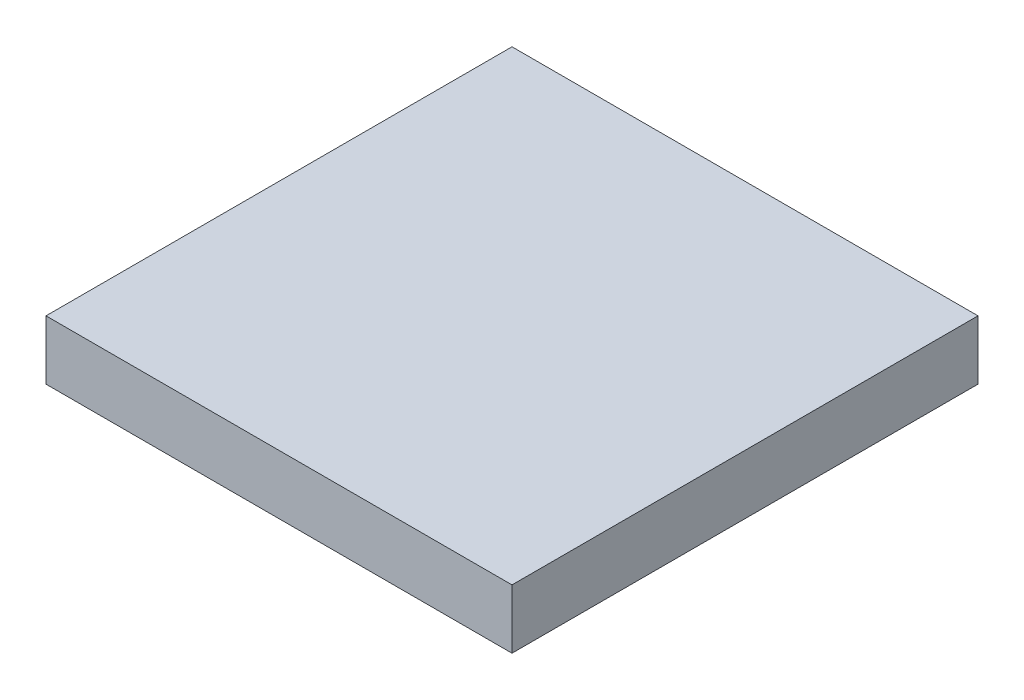
from build123d import *

# Parameters (mm, degrees)
SKETCH1_W           = 100
SKETCH1_H           = 100
BOSS_EXTRUDE1_DEPTH = 12.7


with BuildPart() as part:
    # Sketch1 → Boss-Extrude1 (new body)
    with BuildSketch(Plane(origin=(0, 0, 0), x_dir=(1, 0, 0), z_dir=(0, 1, 0))):
        with Locations((50, 50)):
            Rectangle(SKETCH1_W, SKETCH1_H)
    extrude(amount=BOSS_EXTRUDE1_DEPTH)


solid = part.part
